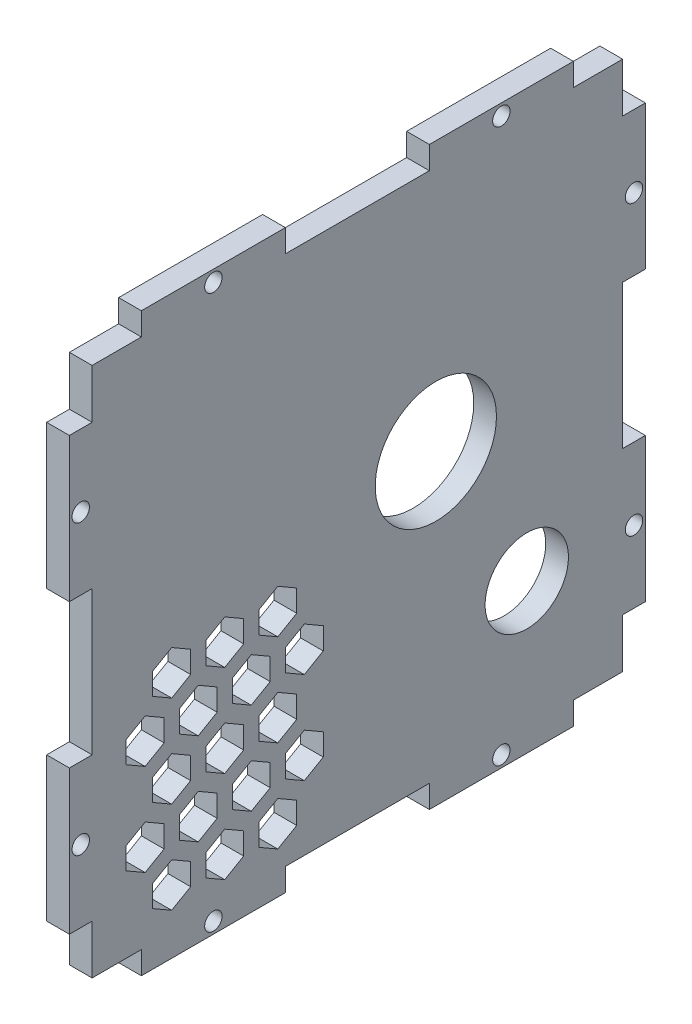
from build123d import *

# Parameters (mm, degrees)
CROQUIS1_W                 = 70
CROQUIS1_H                 = 70
SALIENTE_EXTRUIR1_DEPTH    = 1.5
CROQUIS2_W                 = 19
CROQUIS2_H                 = 3
CROQUIS2_R                 = 1.15
SALIENTE_EXTRUIR2_DEPTH    = 1.5
MATRIZL1_COUNT             = 2
MATRIZL1_PITCH             = 38
SIMETR_A1_COPY_1_SKETCH_W  = 19
SIMETR_A1_COPY_1_SKETCH_H  = 3
SIMETR_A1_COPY_1_SKETCH_R  = 1.15
SIMETR_A1_COPY_1_DEPTH     = 1.5
CROQUIS5_W                 = 3
CROQUIS5_H                 = 19
CROQUIS5_R                 = 1.15
SALIENTE_EXTRUIR3_DEPTH    = 1.5
MATRIZL2_COUNT             = 2
MATRIZL2_PITCH             = 38
SIMETR_A2_COPY_1_SKETCH_W  = 3
SIMETR_A2_COPY_1_SKETCH_H  = 19
SIMETR_A2_COPY_1_SKETCH_R  = 1.15
SIMETR_A2_COPY_1_DEPTH     = 1.5
CORTAR_EXTRUIR2_DEPTH      = 54.761045377
CORTAR_EXTRUIR2_DEPTH_BACK = 54.761045377
CROQUIS4_R                 = 5.5
CORTAR_EXTRUIR3_DEPTH      = 54.761045377
CORTAR_EXTRUIR3_DEPTH_BACK = 54.761045377
CROQUIS6_R                 = 8
CORTAR_EXTRUIR7_DEPTH      = 54.761045377
CORTAR_EXTRUIR7_DEPTH_BACK = 54.761045377
PATR_N_START               = -1.5
PATR_N_DE_RAYADO3_DEPTH    = 3


# Read off the part's stored shape, not the designer's step: Patrón de rayado3
with BuildPart() as part:
    # Croquis1 → Saliente-Extruir1 (new, symmetric)
    with BuildSketch(Plane(origin=(0, 0, 0), x_dir=(0, 0, -1), z_dir=(1, 0, 0))):
        Rectangle(CROQUIS1_W, CROQUIS1_H)
    extrude(amount=SALIENTE_EXTRUIR1_DEPTH, both=True)

    # Croquis2 → Saliente-Extruir2 (add, symmetric)
    with BuildSketch(Plane(origin=(0, 0, 0), x_dir=(0, 0, -1), z_dir=(1, 0, 0))):
        with Locations((-19, 36.5)):
            Rectangle(CROQUIS2_W, CROQUIS2_H)
        with Locations((-19, 36.5)):
            Circle(CROQUIS2_R, mode=Mode.SUBTRACT)
    saliente_extruir2 = extrude(amount=SALIENTE_EXTRUIR2_DEPTH, both=True)

    # MatrizL1: Saliente-Extruir2 ×2
    with Locations(*[(0, 0, -i * MATRIZL1_PITCH) for i in range(1, MATRIZL1_COUNT)]):
        add(saliente_extruir2)

    # Simetría1: Saliente-Extruir2 across plane
    add(saliente_extruir2.mirror(Plane.ZX))

    # Simetría1 copy 1 sketch → Simetría1 copy 1 (add, symmetric)
    with BuildSketch(Plane(origin=(0, 0, -38), x_dir=(0, 0, -1), z_dir=(1, 0, 0))):
        with Locations((-19, -36.5)):
            Rectangle(SIMETR_A1_COPY_1_SKETCH_W, SIMETR_A1_COPY_1_SKETCH_H)
        with Locations((-19, -36.5)):
            Circle(SIMETR_A1_COPY_1_SKETCH_R, mode=Mode.SUBTRACT)
    extrude(amount=SIMETR_A1_COPY_1_DEPTH, both=True)

    # Croquis5 → Saliente-Extruir3 (add, symmetric)
    with BuildSketch(Plane(origin=(0, 0, 0), x_dir=(0, 0, -1), z_dir=(1, 0, 0))):
        with Locations((-36.5, 19)):
            Rectangle(CROQUIS5_W, CROQUIS5_H)
        with Locations((-36.5, 19)):
            Circle(CROQUIS5_R, mode=Mode.SUBTRACT)
    saliente_extruir3 = extrude(amount=SALIENTE_EXTRUIR3_DEPTH, both=True)

    # MatrizL2: Saliente-Extruir3 ×2
    with Locations(*[(0, -i * MATRIZL2_PITCH, 0) for i in range(1, MATRIZL2_COUNT)]):
        add(saliente_extruir3)

    # Simetría2: Saliente-Extruir3 across plane
    add(saliente_extruir3.mirror(Plane.XY))

    # Simetría2 copy 1 sketch → Simetría2 copy 1 (add, symmetric)
    with BuildSketch(Plane(origin=(0, -38, 0), x_dir=(0, 0, 1), z_dir=(1, 0, 0))):
        with Locations((-36.5, -19)):
            Rectangle(SIMETR_A2_COPY_1_SKETCH_W, SIMETR_A2_COPY_1_SKETCH_H)
        with Locations((-36.5, -19)):
            Circle(SIMETR_A2_COPY_1_SKETCH_R, mode=Mode.SUBTRACT)
    extrude(amount=SIMETR_A2_COPY_1_DEPTH, both=True)

    # Croquis4 → Cortar-Extruir2 (cut, two sides: drawn at the far end of the back side and taken through both)
    with BuildSketch(Plane(origin=(0, 0, 0), x_dir=(0, 0, -1), z_dir=(1, 0, 0)).offset(-CORTAR_EXTRUIR2_DEPTH_BACK)):
        with Locations((22.355, -18.3)):
            Circle(CROQUIS4_R)
    extrude(amount=CORTAR_EXTRUIR2_DEPTH + CORTAR_EXTRUIR2_DEPTH_BACK, mode=Mode.SUBTRACT)

    # Croquis6 → Cortar-Extruir3 (cut, two sides: drawn at the far end of the back side and taken through both)
    with BuildSketch(Plane(origin=(0, 0, 0), x_dir=(0, 0, -1), z_dir=(1, 0, 0)).offset(-CORTAR_EXTRUIR3_DEPTH_BACK)):
        with Locations((10.355, 2.5)):
            Circle(CROQUIS6_R)
    extrude(amount=CORTAR_EXTRUIR3_DEPTH + CORTAR_EXTRUIR3_DEPTH_BACK, mode=Mode.SUBTRACT)

    # Croquis11 → Cortar-Extruir7 (cut, two sides: drawn at the far end of the back side and taken through both)
    with BuildSketch(Plane(origin=(0, 0, 0), x_dir=(0, 0, -1), z_dir=(1, 0, 0)).offset(-CORTAR_EXTRUIR7_DEPTH_BACK)):
        Polygon((-20, -16.056624327), (-20, -18.943375673), (-17.5, -20.386751346), (-15, -18.943375673), (-15, -16.056624327), (-17.5, -14.613248654), align=None)
    extrude(amount=CORTAR_EXTRUIR7_DEPTH + CORTAR_EXTRUIR7_DEPTH_BACK, mode=Mode.SUBTRACT)

    # Patrón de rayado3 outline → Patrón de rayado3 (cut)
    with BuildSketch(Plane.YZ.offset(PATR_N_START)):
        Polygon((-20.675426481, 7), (-22.118802154, 9.5), (-25.005553499, 9.5), (-26.448929172, 7), (-25.005553499, 4.5), (-22.118802154, 4.5), align=None)
        Polygon((-8.551070828, 7), (-9.994446501, 9.5), (-12.881197846, 9.5), (-14.324573519, 7), (-12.881197846, 4.5), (-9.994446501, 4.5), align=None)
        Polygon((-22.118802154, 25.5), (-20.675426481, 28), (-22.118802154, 30.5), (-25.005553499, 30.5), (-26.448929172, 28), (-25.005553499, 25.5), align=None)
        Polygon((-12.881197846, 25.5), (-9.994446501, 25.5), (-8.551070828, 28), (-9.994446501, 30.5), (-12.881197846, 30.5), (-14.324573519, 28), align=None)
        Polygon((-32.511106999, 17.5), (-31.067731326, 15), (-28.18097998, 15), (-26.737604307, 17.5), (-28.18097998, 20), (-31.067731326, 20), align=None)
        Polygon((-8.262395693, 17.5), (-6.81902002, 15), (-3.932268674, 15), (-2.488893001, 17.5), (-3.932268674, 20), (-6.81902002, 20), align=None)
        Polygon((-16.056624327, 8), (-14.613248654, 10.5), (-16.056624327, 13), (-18.943375673, 13), (-20.386751346, 10.5), (-18.943375673, 8), align=None)
        Polygon((-22.118802154, 18.5), (-20.675426481, 21), (-22.118802154, 23.5), (-25.005553499, 23.5), (-26.448929172, 21), (-25.005553499, 18.5), align=None)
        Polygon((-12.881197846, 18.5), (-9.994446501, 18.5), (-8.551070828, 21), (-9.994446501, 23.5), (-12.881197846, 23.5), (-14.324573519, 21), align=None)
        Polygon((-8.262395693, 10.5), (-6.81902002, 8), (-3.932268674, 8), (-2.488893001, 10.5), (-3.932268674, 13), (-6.81902002, 13), align=None)
        Polygon((-32.511106999, 10.5), (-31.067731326, 8), (-28.18097998, 8), (-26.737604307, 10.5), (-28.18097998, 13), (-31.067731326, 13), align=None)
        Polygon((-22.118802154, 11.5), (-20.675426481, 14), (-22.118802154, 16.5), (-25.005553499, 16.5), (-26.448929172, 14), (-25.005553499, 11.5), align=None)
        Polygon((-28.18097998, 22), (-26.737604307, 24.5), (-28.18097998, 27), (-31.067731326, 27), (-32.511106999, 24.5), (-31.067731326, 22), align=None)
        Polygon((-18.943375673, 22), (-16.056624327, 22), (-14.613248654, 24.5), (-16.056624327, 27), (-18.943375673, 27), (-20.386751346, 24.5), align=None)
        Polygon((-14.324573519, 14), (-12.881197846, 11.5), (-9.994446501, 11.5), (-8.551070828, 14), (-9.994446501, 16.5), (-12.881197846, 16.5), align=None)
        Polygon((-8.262395693, 24.5), (-6.81902002, 22), (-3.932268674, 22), (-2.488893001, 24.5), (-3.932268674, 27), (-6.81902002, 27), align=None)
    extrude(amount=PATR_N_DE_RAYADO3_DEPTH, mode=Mode.SUBTRACT)


solid = part.part
